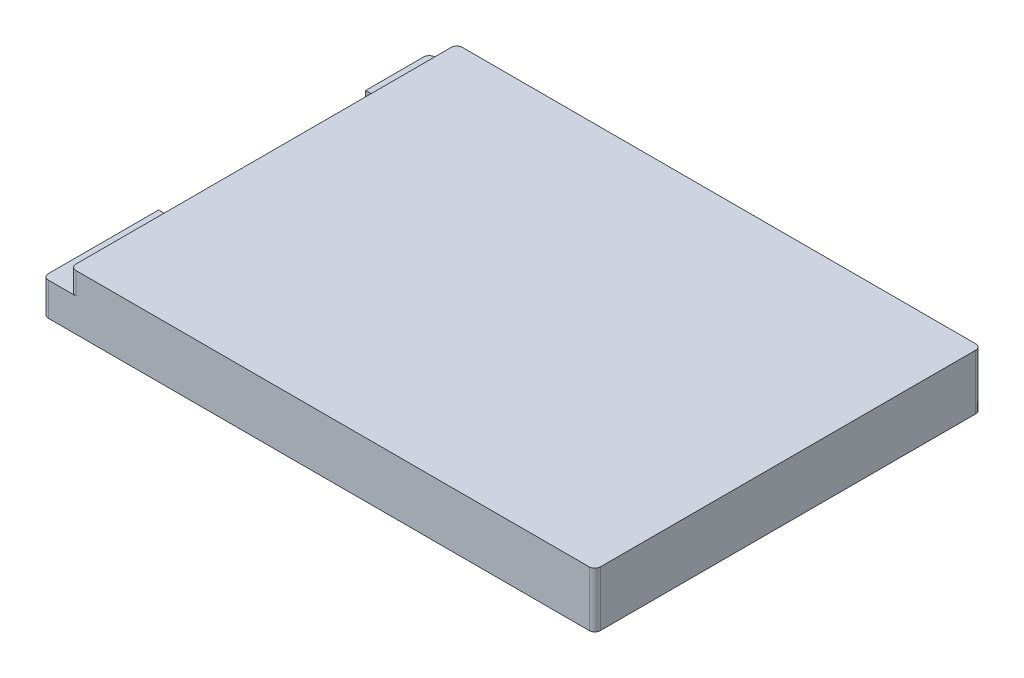
from build123d import *

# Parameters (mm, degrees)
SKETCH1_W           = 100
SKETCH1_H           = 70
BOSS_EXTRUDE1_DEPTH = 10
SKETCH2_R           = 1.5
CUT_EXTRUDE1_DEPTH  = 5
SKETCH3_W           = 17.581829542
SKETCH3_H           = 1.056152304
SKETCH3_W_2         = 9.008357892
CUT_EXTRUDE2_DEPTH  = 5
FILLET1_R           = 1


with BuildPart() as part:
    # Sketch1 → Boss-Extrude1 (new body)
    with BuildSketch(Plane(origin=(0, 0, 0), x_dir=(1, 0, 0), z_dir=(0, 1, 0))):
        with Locations((50, 35)):
            Rectangle(SKETCH1_W, SKETCH1_H)
    extrude(amount=BOSS_EXTRUDE1_DEPTH)

    # Sketch2 → Cut-Extrude1 (cut)
    with BuildSketch(Plane.XZ):
        with Locations((14, -4)):
            Circle(SKETCH2_R)
        with Locations((14, -66)):
            Circle(SKETCH2_R)
        with Locations((91, -66)):
            Circle(SKETCH2_R)
        with Locations((91, -4)):
            Circle(SKETCH2_R)
    extrude(amount=-CUT_EXTRUDE1_DEPTH, mode=Mode.SUBTRACT)

    # Sketch3 → Cut-Extrude2 (cut)
    with BuildSketch(Plane.ZY):
        Polygon((-70, 6), (-70, 10), (0, 10), (0, 6), (-21, 6), (-21, 0), (-58.5, 0), (-58.5, 6), align=None)
        with Locations((-45.810029471, 3.819594483)):
            Rectangle(SKETCH3_W, SKETCH3_H, mode=Mode.SUBTRACT)
        with Locations((-29.035845809, 3.819594483)):
            Rectangle(SKETCH3_W_2, SKETCH3_H, mode=Mode.SUBTRACT)
    extrude(amount=-CUT_EXTRUDE2_DEPTH, mode=Mode.SUBTRACT)

    # Fillet1
    fillet1_edges = [part.edges().sort_by_distance(p)[0] for p in [
        (100, 5, -70),
        (100, 5, 0),
        (5, 8, 0),
        (0, 3, 0),
        (5, 8, -70),
        (0, 3, -70),
    ]]
    fillet(fillet1_edges, radius=FILLET1_R)


solid = part.part
